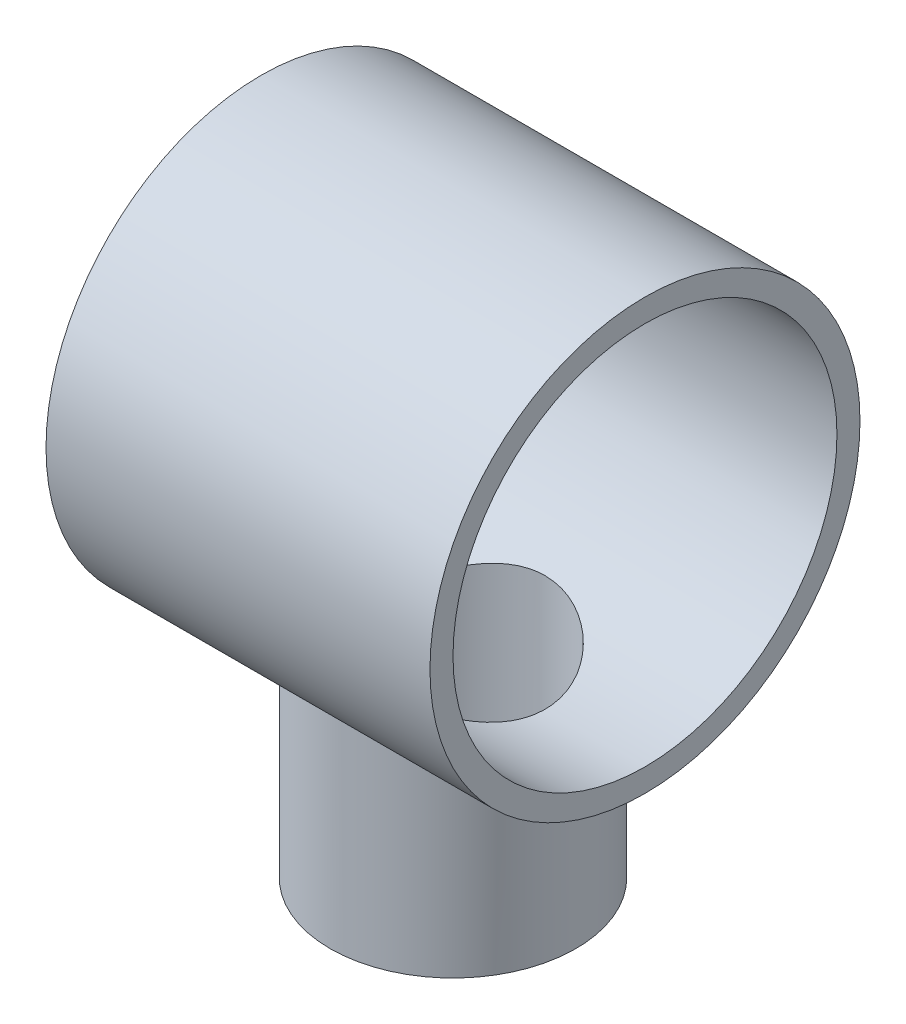
from build123d import *

# Parameters (mm, degrees)
EXTRUDE_1_DEPTH          = 10
EXTRUDE_1_DEPTH_BACK     = 10
SKETCH_1_R               = 8
SKETCH_1_R_2             = 6
SKETCH_2_R               = 14
SKETCH_2_R_2             = 12.5
EXTRUDE_2_DEPTH          = 12.5
CUT_EXTRUDE_1_DEPTH      = 35.543451059
CUT_EXTRUDE_1_DEPTH_BACK = 35.543451059
SKETCH_3_R               = 12.5
SKETCH_4_R               = 6
CUT_EXTRUDE_2_DEPTH      = 20


with BuildPart() as part:
    # 草图1 → 凸台-拉伸1 (new, two sides: drawn at the far end of the back side and taken through both)
    with BuildSketch(Plane(origin=(0, 0, 0), x_dir=(1, 0, 0), z_dir=(0, 1, 0)).offset(-EXTRUDE_1_DEPTH_BACK)):
        Circle(SKETCH_1_R)
        Circle(SKETCH_1_R_2, mode=Mode.SUBTRACT)
    extrude(amount=EXTRUDE_1_DEPTH + EXTRUDE_1_DEPTH_BACK)

    # 草图2 → 凸台-拉伸2 (add, symmetric)
    with BuildSketch(Plane(origin=(0, 0, 0), x_dir=(0, 0, -1), z_dir=(1, 0, 0))):
        with Locations((0, 15)):
            Circle(SKETCH_2_R)
        with Locations((0, 15)):
            Circle(SKETCH_2_R_2, mode=Mode.SUBTRACT)
    extrude(amount=EXTRUDE_2_DEPTH, both=True)

    # 草图3 → 切除-拉伸1 (cut, two sides: drawn at the far end of the back side and taken through both)
    with BuildSketch(Plane(origin=(0, 0, 0), x_dir=(0, 0, -1), z_dir=(1, 0, 0)).offset(-CUT_EXTRUDE_1_DEPTH_BACK)):
        with Locations((0, 15)):
            Circle(SKETCH_3_R)
    extrude(amount=CUT_EXTRUDE_1_DEPTH + CUT_EXTRUDE_1_DEPTH_BACK, mode=Mode.SUBTRACT)

    # 草图4 → 切除-拉伸2 (cut)
    with BuildSketch(Plane.XZ.offset(10)):
        Circle(SKETCH_4_R)
    extrude(amount=-CUT_EXTRUDE_2_DEPTH, mode=Mode.SUBTRACT)


solid = part.part
